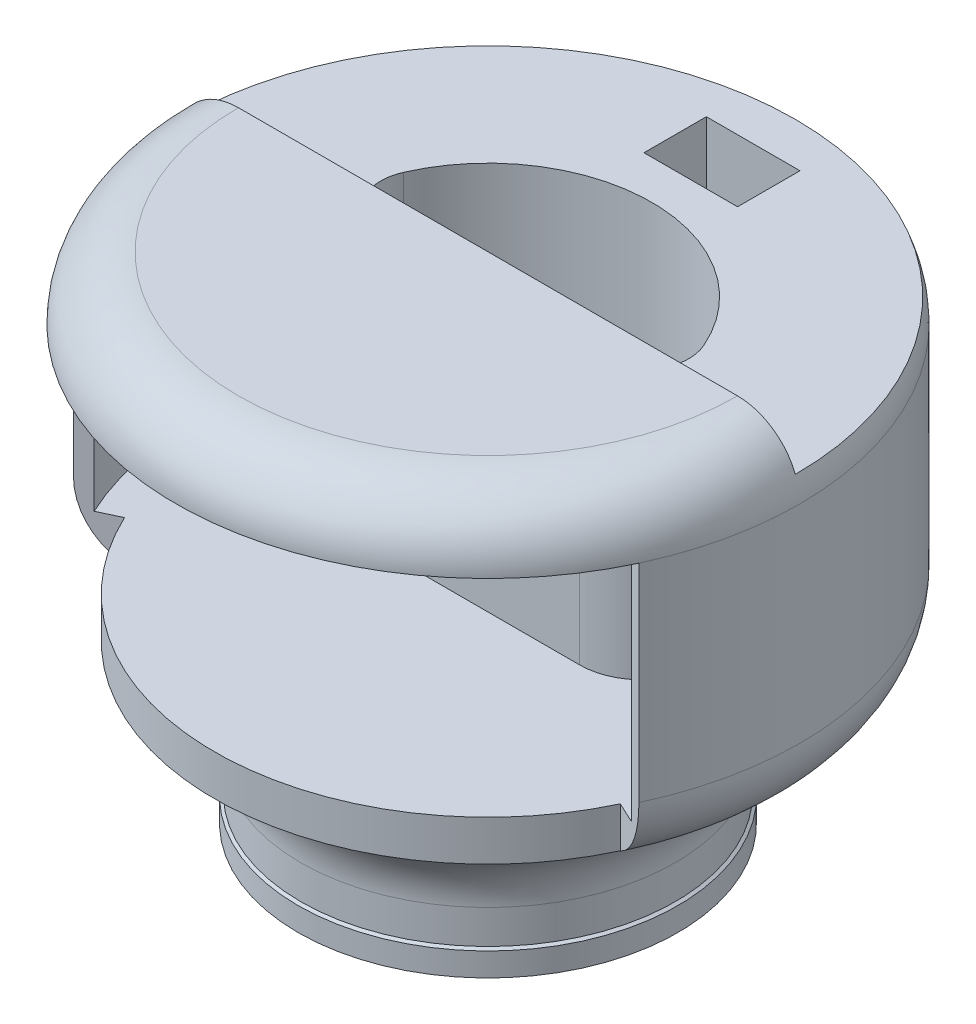
from build123d import *

# Parameters (mm, degrees)
CUT_EXTRUDE3_DEPTH           = 60
CUT_EXTRUDE5_DEPTH           = 2
CUT_EXTRUDE5_DEPTH_BACK      = 30
SKETCH9_R                    = 38
SKETCH9_R_2                  = 23
SKETCH19_W                   = 12
SKETCH19_H                   = 36.5
CUT_REVOLVE2_ANGLE           = 65
CUT_REVOLVE2_OTHER_WAY_ANGLE = 65
SKETCH21_W                   = 3.25
SKETCH21_H                   = 4
BOSS_EXTRUDE3_DEPTH          = 1.35
CIRPATTERN1_COUNT            = 5
CUT_EXTRUDE9_START           = -5
CUT_EXTRUDE9_DEPTH           = 5
SKETCH23_R                   = 10.5
CUT_EXTRUDE10_DEPTH          = 10
SKETCH24_W                   = 17
SKETCH24_H                   = 12
BOSS_EXTRUDE4_DEPTH          = 8
SKETCH26_W                   = 12
SKETCH26_H                   = 8
CUT_EXTRUDE11_DEPTH          = 10
SKETCH27_W                   = 4
SKETCH27_H                   = 5
CUT_EXTRUDE12_DEPTH          = 5
CUT_EXTRUDE14_DEPTH          = 2
CUT_EXTRUDE14_DEPTH_BACK     = 30
SKETCH29_R                   = 1
CUT_EXTRUDE15_DEPTH          = 15
FILLET1_R                    = 6
FILLET2_R                    = 8


with BuildPart() as part:
    # Sketch1 → Revolve1 (revolve)
    with BuildSketch(Plane.XY):
        with BuildLine():
            Line((0, 63.427876097), (32, 63.427876097))
            ThreePointArc((32, 63.427876097), (37.656854249, 61.084730346), (40, 55.427876097))
            Line((40, 55.427876097), (40, 28.846818009))
            ThreePointArc((40, 28.846818009), (38.792081772, 24.082439968), (35.460140376, 20.469057744))
            Line((35.460140376, 20.469057744), (28.539859624, 15.958818353))
            ThreePointArc((28.539859624, 15.958818353), (25.207918228, 12.345436129), (24, 7.581058088))
            Line((24, 7.581058088), (24, 3.25))
            Line((24, 3.25), (24.35, 3))
            Line((24.35, 3), (24.35, 0))
            Line((24.35, 0), (22.5, 0))
            Line((22.5, 0), (22.5, 12.5))
            ThreePointArc((22.5, 12.5), (22.353553391, 12.853553391), (22, 13))
            Line((22, 13), (0, 13))
            Line((0, 13), (0, 63.427876097))
        make_face()
    revolve(axis=Axis((0, 0, 0), (0, 1, 0)))

    # Sketch11 → Cut-Extrude3 (cut)
    with BuildSketch(Plane(origin=(0, 13, 0), x_dir=(-1, 0, 0), z_dir=(0, -1, 0))):
        with BuildLine():
            Line((-21, 0), (21, 0))
            ThreePointArc((21, 0), (0, 21), (-21, 0))
        make_face()
    extrude(amount=-CUT_EXTRUDE3_DEPTH, mode=Mode.SUBTRACT)

    # Sketch9 → Cut-Extrude5 (cut, two sides: drawn at the far end of the back side and taken through both)
    with BuildSketch(Plane(origin=(0, 55.427876097, 0), x_dir=(1, 0, 0), z_dir=(0, 1, 0)).offset(-CUT_EXTRUDE5_DEPTH_BACK)):
        Circle(SKETCH9_R)
        Circle(SKETCH9_R_2, mode=Mode.SUBTRACT)
    extrude(amount=CUT_EXTRUDE5_DEPTH + CUT_EXTRUDE5_DEPTH_BACK, mode=Mode.SUBTRACT)

    # Sketch19 → Cut-Revolve2 (revolve, cut)
    with BuildSketch(Plane(origin=(0, 0, 0), x_dir=(0, 0, -1), z_dir=(1, 0, 0))):
        with Locations((-41.064715832, 37.177876097)):
            Rectangle(SKETCH19_W, SKETCH19_H)
    revolve(axis=Axis((0, 0, 0), (0, 1, 0)), revolution_arc=CUT_REVOLVE2_ANGLE, mode=Mode.SUBTRACT)

    # Sketch19 → Cut-Revolve2 other way (revolve, cut)
    with BuildSketch(Plane(origin=(0, 0, 0), x_dir=(0, 0, -1), z_dir=(1, 0, 0))):
        with Locations((-41.064715832, 37.177876097)):
            Rectangle(SKETCH19_W, SKETCH19_H)
    revolve(axis=Axis((0, 0, 0), (0, -1, 0)), revolution_arc=CUT_REVOLVE2_OTHER_WAY_ANGLE, mode=Mode.SUBTRACT)

    # Sketch21 → Boss-Extrude3 (add)
    with BuildSketch(Plane(origin=(0, 0, 22.5), x_dir=(-1, 0, 0), z_dir=(0, 0, -1))):
        with Locations((0, 2)):
            Rectangle(SKETCH21_W, SKETCH21_H)
    boss_extrude3 = extrude(amount=BOSS_EXTRUDE3_DEPTH)

    # CirPattern1: Boss-Extrude3 ×5 about axis
    cirpattern1_axis = Axis((0, 0, 0), (0, -1, 0))
    for i in range(1, CIRPATTERN1_COUNT):
        add(boss_extrude3.rotate(cirpattern1_axis, i * 360 / CIRPATTERN1_COUNT))

    # Sketch22 → Cut-Extrude9 (cut)
    with BuildSketch(Plane(origin=(0, 63.427876097, 0), x_dir=(1, 0, 0), z_dir=(0, 1, 0)).offset(CUT_EXTRUDE9_START)):
        with BuildLine():
            Line((-40, 0), (40, 0))
            ThreePointArc((40, 0), (0, 40), (-40, 0))
        make_face()
    extrude(amount=CUT_EXTRUDE9_DEPTH, mode=Mode.SUBTRACT)

    # Sketch23 → Cut-Extrude10 (cut)
    with BuildSketch(Plane(origin=(0, 0, -40), x_dir=(-1, 0, 0), z_dir=(0, 0, -1))):
        with Locations((0, 42.137876097)):
            Circle(SKETCH23_R)
    extrude(amount=-CUT_EXTRUDE10_DEPTH, mode=Mode.SUBTRACT)

    # Sketch24 → Boss-Extrude4 (add)
    with BuildSketch(Plane(origin=(0, 58.427876097, 0), x_dir=(1, 0, 0), z_dir=(0, 1, 0))):
        with Locations((0, 30)):
            Rectangle(SKETCH24_W, SKETCH24_H)
    extrude(amount=-BOSS_EXTRUDE4_DEPTH)

    # Sketch26 → Cut-Extrude11 (cut)
    with BuildSketch(Plane(origin=(0, 58.427876097, 0), x_dir=(1, 0, 0), z_dir=(0, 1, 0))):
        with Locations((0, 30)):
            Rectangle(SKETCH26_W, SKETCH26_H)
    extrude(amount=-CUT_EXTRUDE11_DEPTH, mode=Mode.SUBTRACT)

    # Sketch27 → Cut-Extrude12 (cut)
    with BuildSketch(Plane(origin=(8.5, 0, 0), x_dir=(0, 0, -1), z_dir=(1, 0, 0))):
        with Locations((30, 53.927876097)):
            Rectangle(SKETCH27_W, SKETCH27_H)
    extrude(amount=-CUT_EXTRUDE12_DEPTH, mode=Mode.SUBTRACT)

    # Sketch28 → Cut-Extrude14 (cut, two sides: drawn at the far end of the back side and taken through both)
    with BuildSketch(Plane(origin=(0, 55.427876097, 0), x_dir=(1, 0, 0), z_dir=(0, 1, 0)).offset(-CUT_EXTRUDE14_DEPTH_BACK)):
        with BuildLine():
            Line((-22.912878475, -2), (22.912878475, -2))
            ThreePointArc((22.912878475, -2), (0, -23), (-22.912878475, -2))
        make_face()
    extrude(amount=CUT_EXTRUDE14_DEPTH + CUT_EXTRUDE14_DEPTH_BACK, mode=Mode.SUBTRACT)

    # Sketch29 → Cut-Extrude15 (cut)
    with BuildSketch(Plane(origin=(0, 0, 0), x_dir=(-1, 0, 0), z_dir=(0, 0, -1))):
        with Locations((-30.416198487, 60.927876097)):
            Circle(SKETCH29_R)
        with Locations((30.416198487, 60.927876097)):
            Circle(SKETCH29_R)
        with Locations((0, 60.927876097)):
            Circle(SKETCH29_R)
    extrude(amount=-CUT_EXTRUDE15_DEPTH, mode=Mode.SUBTRACT)

    # Fillet1
    fillet1_edges = [part.edges().sort_by_distance(p)[0] for p in [
        (-21, 35.713938048, 0),
        (21, 35.713938048, 0),
    ]]
    fillet(fillet1_edges, radius=FILLET1_R)

    # Fillet2
    fillet2_edges = [part.edges().sort_by_distance(p)[0] for p in [
        (22.912878475, 41.427876097, 2),
        (-22.912878475, 41.427876097, 2),
    ]]
    fillet(fillet2_edges, radius=FILLET2_R)


solid = part.part
